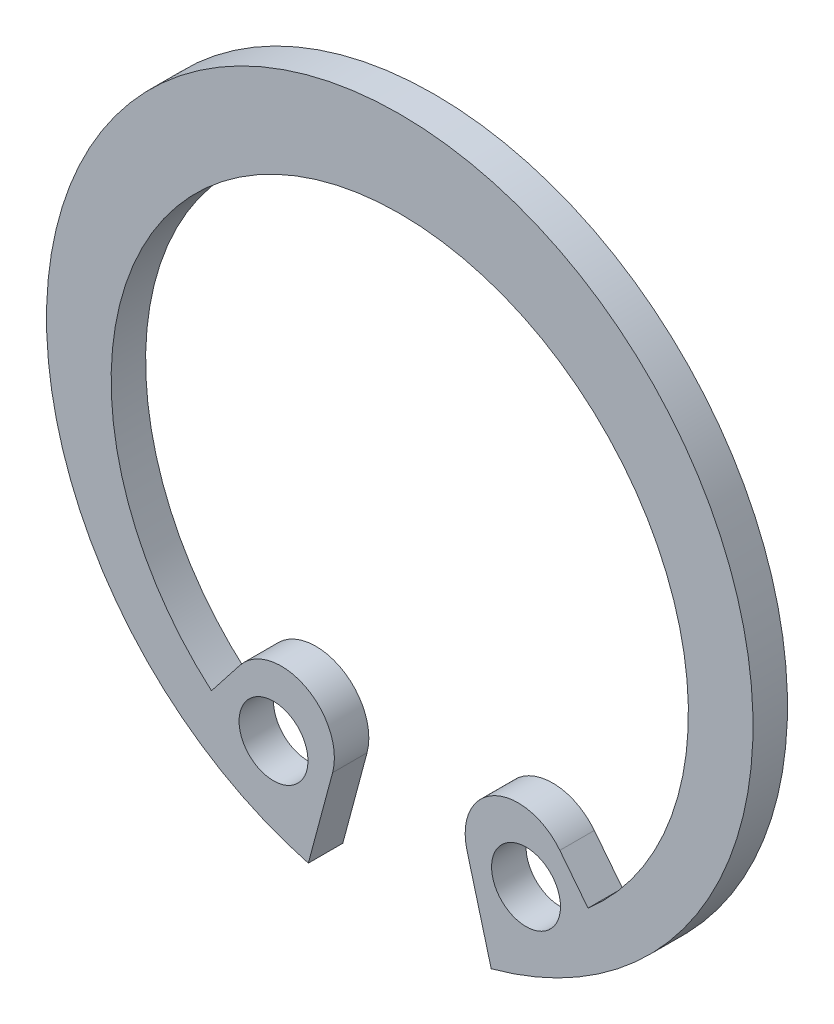
from build123d import *

# Parameters (mm, degrees)
SKETCH2_R           = 1
BOSS_EXTRUDE1_DEPTH = 1
FILLET1_R           = 1.5375


with BuildPart() as part:
    # Sketch2 → Boss-Extrude1 (new body)
    with BuildSketch(Plane.XY):
        with BuildLine():
            Line((3.870772643, -4.941210038), (5.462614208, -6.973265197))
            ThreePointArc((5.462614208, -6.973265197), (7.851985291, 2.288237372), (0, 7.75))
            Line((0, 7.75), (0, 10.25))
            ThreePointArc((0, 10.25), (10.162309829, 1.33789347), (2.652895212, -9.900739719))
            Line((2.652895212, -9.900739719), (1.624559903, -6.062940097))
            Line((1.624559903, -6.062940097), (3.870772643, -4.941210038))
        make_face()
        with Locations((3.663555031, -7.33610009)):
            Circle(SKETCH2_R, mode=Mode.SUBTRACT)
    extrude(amount=BOSS_EXTRUDE1_DEPTH)

    # Fillet1
    fillet1_edges = [part.edges().sort_by_distance(p)[0] for p in [
        (3.870772643, -4.941210038, 0.5),
        (1.624559903, -6.062940097, 0.5),
    ]]
    fillet(fillet1_edges, radius=FILLET1_R - 0.0001)  # a hair under: the kernel refuses the full size

    # Mirror1: part across plane


with BuildPart() as part_1:
    add(part.part)
    add(part.part.mirror(Plane(origin=(0, 10.25, 1), x_dir=(0, 0, 1), z_dir=(1, 0, 0))))


solid = part_1.part
